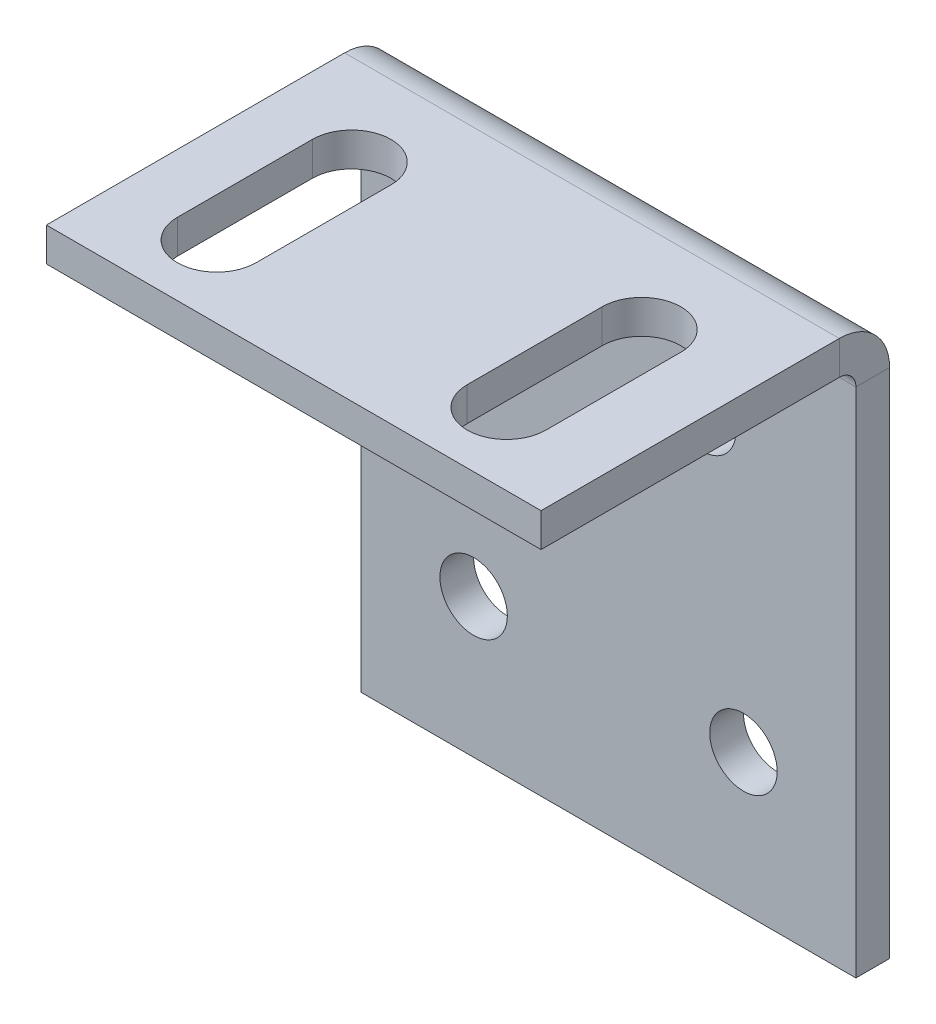
from build123d import *

# Parameters (mm, degrees)
SKETCH1_W                    = 22
SKETCH1_H                    = 25
SKETCH1_R                    = 1.5
BASE_FLANGE1_DEPTH           = 1.5
EDGE_FLANGE1_STRIP_W         = 7.4732
EDGE_FLANGE1_STRIP_H         = 1.5
EDGE_FLANGE1_STRIP_CUT_DEPTH = 22
EDGE_FLANGE1_DEPTH           = 22
CUT_EXTRUDE1_DEPTH           = 10


# Sheet-metal steps are written as plain solids
with BuildPart() as part:
    # Sketch1 → Base-Flange1 (new body)
    with BuildSketch(Plane.XY):
        with Locations((0.834482759, -7.531034483)):
            Rectangle(SKETCH1_W, SKETCH1_H)
        with Locations((6.834482759, -13.834829283)):
            Circle(SKETCH1_R, mode=Mode.SUBTRACT)
        with Locations((-5.165517241, -13.834829283)):
            Circle(SKETCH1_R, mode=Mode.SUBTRACT)
        with Locations((-3.415517241, -1.662801421)):
            Circle(SKETCH1_R, mode=Mode.SUBTRACT)
        with Locations((4.994482759, -1.662801421)):
            Circle(SKETCH1_R, mode=Mode.SUBTRACT)
    extrude(amount=-BASE_FLANGE1_DEPTH)

    # Edge-Flange1 strip (across the edge) → Edge-Flange1 strip cut (cut)
    with BuildSketch(Plane(origin=(11.834482759, 4.968965517, 0), x_dir=(0, -1, 0), z_dir=(-1, 0, 0))):
        with Locations((-1.5, -0.75)):
            Rectangle(EDGE_FLANGE1_STRIP_W, EDGE_FLANGE1_STRIP_H)
    extrude(amount=EDGE_FLANGE1_STRIP_CUT_DEPTH, mode=Mode.SUBTRACT)

    # Edge-Flange1 section (across the edge) → Edge-Flange1 (add)
    with BuildSketch(Plane(origin=(11.834482759, 4.968965517, 0), x_dir=(0, -1, 0), z_dir=(-1, 0, 0))):
        with BuildLine():
            Line((0, 0.7366), (0, 14))
            Line((0, 14), (1.5, 14))
            Line((1.5, 14), (1.5, 0.7366))
            ThreePointArc((1.5, 0.7366), (1.715745145, 0.215745145), (2.2366, 0))
            Line((2.2366, 0), (2.2366, -1.5))
            ThreePointArc((2.2366, -1.5), (0.655084973, -0.844915027), (0, 0.7366))
        make_face()
    extrude(amount=EDGE_FLANGE1_DEPTH)

    # Sketch11 → Cut-Extrude1 (cut)
    with BuildSketch(Plane(origin=(0, 4.968965517, 0), x_dir=(1, 0, 0), z_dir=(0, 1, 0))):
        with BuildLine():
            Line((-4.050745128, -10.789495208), (-4.050745128, -4.789495208))
            ThreePointArc((-4.050745128, -4.789495208), (-5.800745128, -3.039495208), (-7.550745128, -4.789495208))
            Line((-7.550745128, -4.789495208), (-7.550745128, -10.789495208))
            ThreePointArc((-7.550745128, -10.789495208), (-5.800745128, -12.539495208), (-4.050745128, -10.789495208))
        make_face()
        with BuildLine():
            Line((8.840531004, -10.789495208), (8.840531004, -4.789495208))
            ThreePointArc((8.840531004, -4.789495208), (7.090531004, -3.039495208), (5.340531004, -4.789495208))
            Line((5.340531004, -4.789495208), (5.340531004, -10.789495208))
            ThreePointArc((5.340531004, -10.789495208), (7.090531004, -12.539495208), (8.840531004, -10.789495208))
        make_face()
    extrude(amount=-CUT_EXTRUDE1_DEPTH, mode=Mode.SUBTRACT)


solid = part.part
